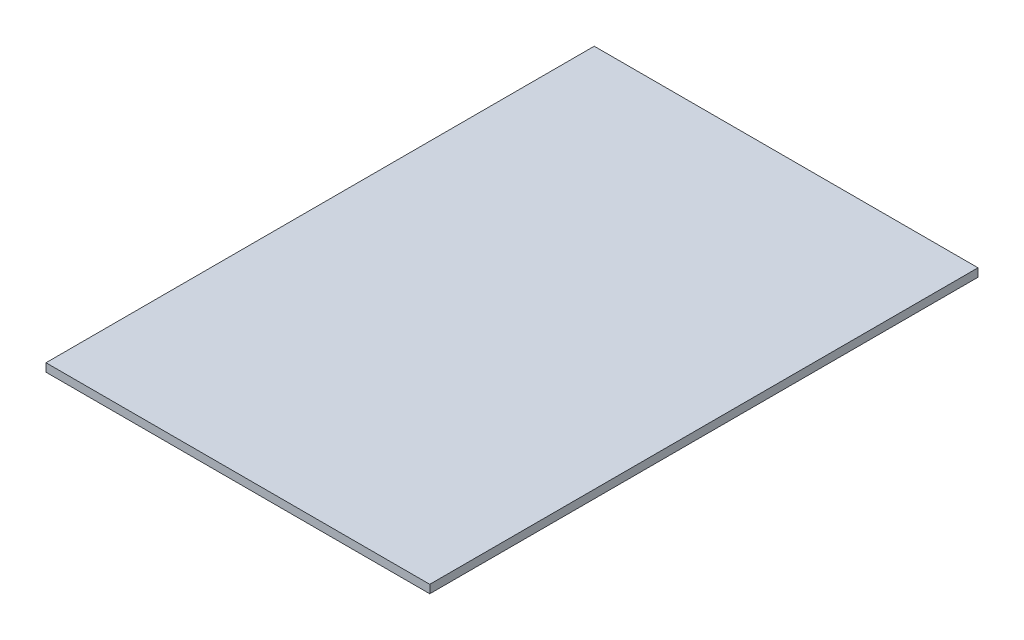
from build123d import *

# Parameters (mm, degrees)
SKETCH1_W           = 140
SKETCH1_H           = 200
BOSS_EXTRUDE1_DEPTH = 3


with BuildPart() as part:
    # Sketch1 → Boss-Extrude1 (new body)
    with BuildSketch(Plane(origin=(0, 0, 0), x_dir=(1, 0, 0), z_dir=(0, 1, 0))):
        Rectangle(SKETCH1_W, SKETCH1_H)
    extrude(amount=BOSS_EXTRUDE1_DEPTH)


solid = part.part
